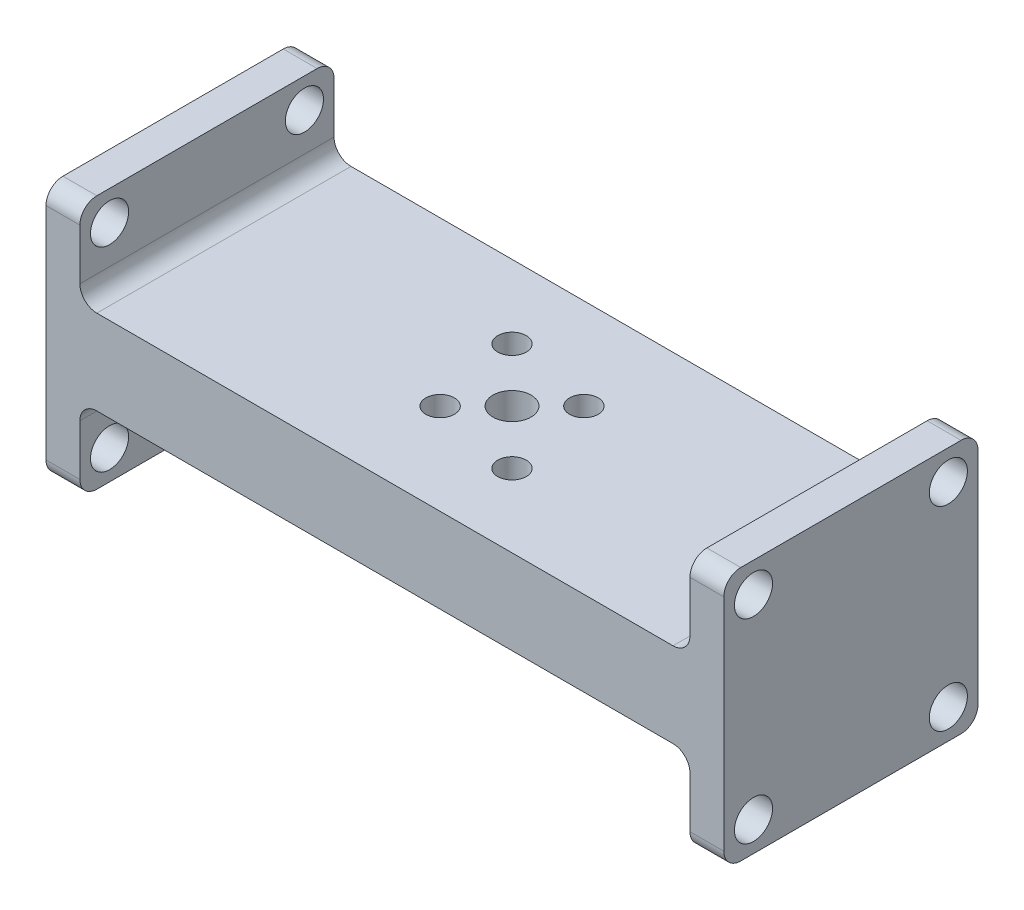
from build123d import *

# Parameters (mm, degrees)
SKETCH2_W           = 72
SKETCH2_H           = 30
SKETCH2_R           = 1.6875
SKETCH2_R_2         = 2.25
BOSS_EXTRUDE1_DEPTH = 10
SKETCH3_W           = 30
SKETCH3_H           = 30
SKETCH3_R           = 2.25
BOSS_EXTRUDE2_DEPTH = 4
FILLET1_R           = 2
FILLET2_R           = 2


with BuildPart() as part:
    # Sketch2 → Boss-Extrude1 (new body)
    with BuildSketch(Plane(origin=(0, 0, 0), x_dir=(1, 0, 0), z_dir=(0, 1, 0))):
        Rectangle(SKETCH2_W, SKETCH2_H)
        with Locations((-4.242640687, -4.242640687)):
            Circle(SKETCH2_R, mode=Mode.SUBTRACT)
        with Locations((6.363961031, -6.363961031)):
            Circle(SKETCH2_R, mode=Mode.SUBTRACT)
        with Locations((-6.363961031, 6.363961031)):
            Circle(SKETCH2_R, mode=Mode.SUBTRACT)
        Circle(SKETCH2_R_2, mode=Mode.SUBTRACT)
        with Locations((4.242640687, 4.242640687)):
            Circle(SKETCH2_R, mode=Mode.SUBTRACT)
    extrude(amount=BOSS_EXTRUDE1_DEPTH)

    # Sketch3 → Boss-Extrude2 (add)
    with BuildSketch(Plane.ZY.offset(36)):
        with Locations((0, 5)):
            Rectangle(SKETCH3_W, SKETCH3_H)
        with Locations((-11.5, -6.5)):
            Circle(SKETCH3_R, mode=Mode.SUBTRACT)
        with Locations((11.5, -6.5)):
            Circle(SKETCH3_R, mode=Mode.SUBTRACT)
        with Locations((-11.5, 16.5)):
            Circle(SKETCH3_R, mode=Mode.SUBTRACT)
        with Locations((11.5, 16.5)):
            Circle(SKETCH3_R, mode=Mode.SUBTRACT)
    boss_extrude2 = extrude(amount=BOSS_EXTRUDE2_DEPTH)

    # Mirror1: Boss-Extrude2 across plane
    add(boss_extrude2.mirror(Plane(origin=(0, 0, 0), x_dir=(0, 0, 1), z_dir=(1, 0, 0))))

    # Fillet1
    fillet1_edges = [part.edges().sort_by_distance(p)[0] for p in [
        (-36, 0, 0),
        (36, 0, 0),
        (36, 10, 0),
        (-36, 10, 0),
    ]]
    fillet(fillet1_edges, radius=FILLET1_R)

    # Fillet2
    fillet2_edges = [part.edges().sort_by_distance(p)[0] for p in [
        (38, -10, -15),
        (-38, -10, -15),
        (38, -10, 15),
        (38, 20, 15),
        (38, 20, -15),
        (-38, -10, 15),
        (-38, 20, 15),
        (-38, 20, -15),
    ]]
    fillet(fillet2_edges, radius=FILLET2_R)


solid = part.part
